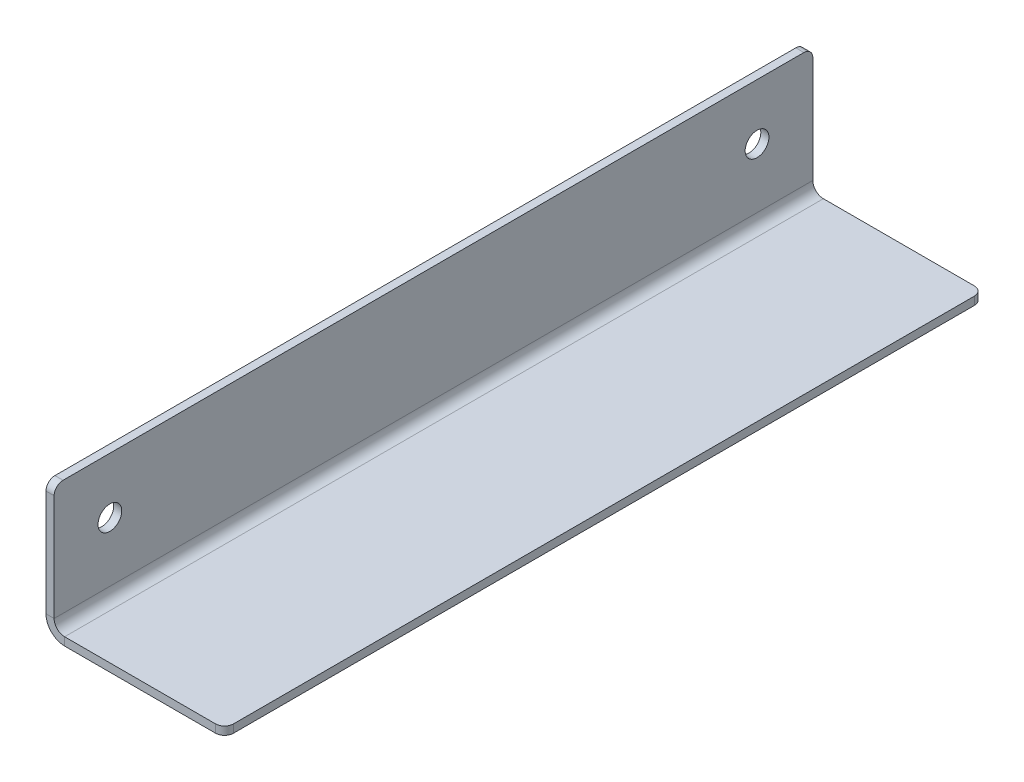
from build123d import *

# Parameters (mm, degrees)
SKETCH1_W                    = 38.1
SKETCH1_H                    = 215.9
BASE_FLANGE1_DEPTH           = 2.304796
EDGE_FLANGE1_STRIP_W         = 15.219184
EDGE_FLANGE1_STRIP_H         = 2.304796
EDGE_FLANGE1_STRIP_CUT_DEPTH = 215.9
EDGE_FLANGE1_DEPTH           = 215.9
F_1_4_CLEARANCE_HOLE1_D      = 6.7564
FILLET1_R                    = 2.54


# Sheet-metal steps are written as plain solids
with BuildPart() as part:
    # Sketch1 → Base-Flange1 (new body)
    with BuildSketch(Plane(origin=(0, 0, 0), x_dir=(0, -1, 0), z_dir=(1, 0, 0))):
        with Locations((-19.05, -107.95)):
            Rectangle(SKETCH1_W, SKETCH1_H)
    extrude(amount=-BASE_FLANGE1_DEPTH)

    # Edge-Flange1 strip (across the edge) → Edge-Flange1 strip cut (cut)
    with BuildSketch(Plane.YX.offset(-215.9)):
        with Locations((-2.304796, -1.152398)):
            Rectangle(EDGE_FLANGE1_STRIP_W, EDGE_FLANGE1_STRIP_H)
    extrude(amount=EDGE_FLANGE1_STRIP_CUT_DEPTH, mode=Mode.SUBTRACT)

    # Edge-Flange1 section (across the edge) → Edge-Flange1 (add)
    with BuildSketch(Plane.YX.offset(-215.9)):
        with BuildLine():
            Line((0, 3), (0, 48.495204))
            Line((0, 48.495204), (2.304796, 48.495204))
            Line((2.304796, 48.495204), (2.304796, 3))
            ThreePointArc((2.304796, 3), (3.183475656, 0.878679656), (5.304796, 0))
            Line((5.304796, 0), (5.304796, -2.304796))
            ThreePointArc((5.304796, -2.304796), (1.553738776, -0.751057224), (0, 3))
        make_face()
    extrude(amount=EDGE_FLANGE1_DEPTH)

    # 1/4 Clearance Hole1 (through all)
    with Locations(Plane.ZY.offset(2.304796)):
        with Locations((15.875, 22.225), (200.025, 22.225)):
            Hole(F_1_4_CLEARANCE_HOLE1_D / 2)

    # Fillet1
    fillet1_edges = [part.edges().sort_by_distance(p)[0] for p in [
        (48.495204, 1.152398, 215.9),
        (48.495204, 1.152398, 0),
        (-1.152398, 38.1, 215.9),
        (-1.152398, 38.1, 0),
    ]]
    fillet(fillet1_edges, radius=FILLET1_R)


solid = part.part
